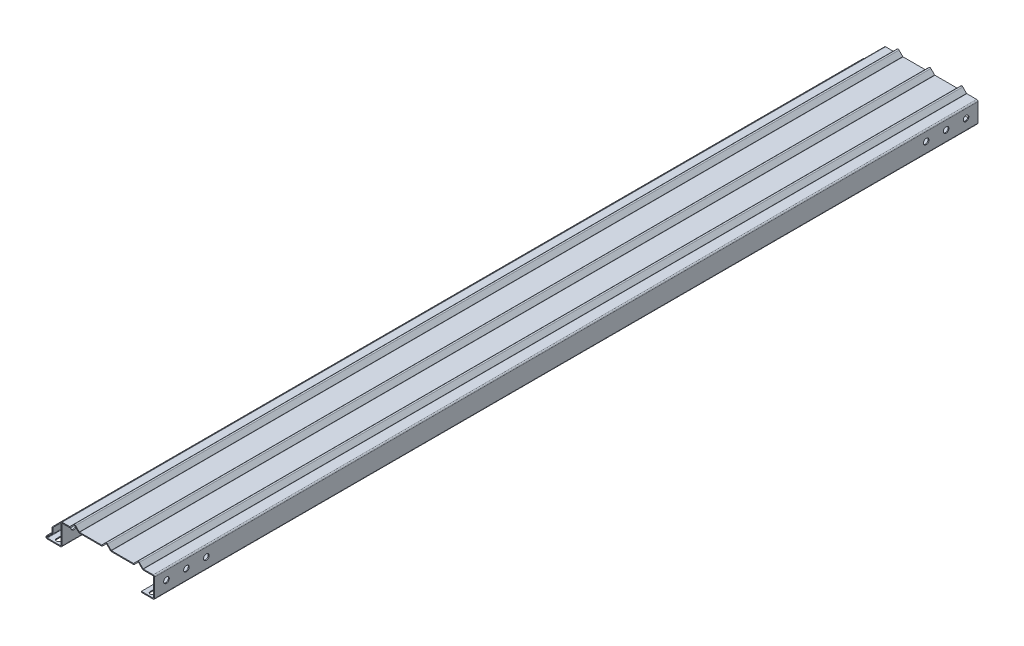
from build123d import *

# Parameters (mm, degrees)
SM_BASE_FLANGE_1_DEPTH = 2066
CUT_EXTRUDE_2_DEPTH    = 2.3
CUT_EXTRUDE_3_REACH    = 2082.367
CUT_EXTRUDE_4_REACH    = 2086.839
SKETCH_8_R             = 7
SKETCH_9_W             = 15
SKETCH_9_H             = 12
CUT_EXTRUDE_5_DEPTH    = 10


# Sheet-metal steps are written as plain solids
with BuildPart() as part:
    # Sketch 1 → 基体-法兰1 (new body)
    with BuildSketch(Plane.XY):
        with BuildLine():
            Line((-35, 15), (-35, 1))
            ThreePointArc((-35, 1), (-34.707106781, 0.292893219), (-34, 0))
            Line((-34, 0), (-1, 0))
            ThreePointArc((-1, 0), (-0.292893219, 0.292893219), (0, 1))
            Line((0, 1), (0, 49.7))
            ThreePointArc((0, 49.7), (0.966547622, 52.033452378), (3.3, 53))
            Line((3.3, 53), (22.085786438, 53))
            ThreePointArc((22.085786438, 53), (22.46846987, 53.076120467), (22.792893219, 53.292893219))
            Line((22.792893219, 53.292893219), (32.166547622, 62.666547622))
            ThreePointArc((32.166547622, 62.666547622), (34.5, 63.633095244), (36.833452378, 62.666547622))
            Line((36.833452378, 62.666547622), (46.207106781, 53.292893219))
            ThreePointArc((46.207106781, 53.292893219), (46.53153013, 53.076120467), (46.914213562, 53))
            Line((46.914213562, 53), (102.085786438, 53))
            ThreePointArc((102.085786438, 53), (102.46846987, 53.076120467), (102.792893219, 53.292893219))
            Line((102.792893219, 53.292893219), (112.166547622, 62.666547622))
            ThreePointArc((112.166547622, 62.666547622), (114.5, 63.633095244), (116.833452378, 62.666547622))
            Line((116.833452378, 62.666547622), (126.207106781, 53.292893219))
            ThreePointArc((126.207106781, 53.292893219), (126.53153013, 53.076120467), (126.914213562, 53))
            Line((126.914213562, 53), (182.085786438, 53))
            ThreePointArc((182.085786438, 53), (182.46846987, 53.076120467), (182.792893219, 53.292893219))
            Line((182.792893219, 53.292893219), (192.166547622, 62.666547622))
            ThreePointArc((192.166547622, 62.666547622), (194.5, 63.633095244), (196.833452378, 62.666547622))
            Line((196.833452378, 62.666547622), (206.207106781, 53.292893219))
            ThreePointArc((206.207106781, 53.292893219), (206.53153013, 53.076120467), (206.914213562, 53))
            Line((206.914213562, 53), (231.7, 53))
            ThreePointArc((231.7, 53), (234.033452378, 52.033452378), (235, 49.7))
            Line((235, 49.7), (235, 3.3))
            ThreePointArc((235, 3.3), (234.033452378, 0.966547622), (231.7, 0))
            Line((231.7, 0), (202, 0))
            Line((202, 0), (202, 2.3))
            Line((202, 2.3), (231.7, 2.3))
            ThreePointArc((231.7, 2.3), (232.407106781, 2.592893219), (232.7, 3.3))
            Line((232.7, 3.3), (232.7, 49.7))
            ThreePointArc((232.7, 49.7), (232.407106781, 50.407106781), (231.7, 50.7))
            Line((231.7, 50.7), (206.914213562, 50.7))
            ThreePointArc((206.914213562, 50.7), (205.651358236, 50.951197543), (204.580761184, 51.666547622))
            Line((204.580761184, 51.666547622), (195.207106781, 61.040202025))
            ThreePointArc((195.207106781, 61.040202025), (194.5, 61.333095244), (193.792893219, 61.040202025))
            Line((193.792893219, 61.040202025), (184.419238816, 51.666547622))
            ThreePointArc((184.419238816, 51.666547622), (183.348641764, 50.951197543), (182.085786438, 50.7))
            Line((182.085786438, 50.7), (126.914213562, 50.7))
            ThreePointArc((126.914213562, 50.7), (125.651358236, 50.951197543), (124.580761184, 51.666547622))
            Line((124.580761184, 51.666547622), (115.207106781, 61.040202025))
            ThreePointArc((115.207106781, 61.040202025), (114.5, 61.333095244), (113.792893219, 61.040202025))
            Line((113.792893219, 61.040202025), (104.419238816, 51.666547622))
            ThreePointArc((104.419238816, 51.666547622), (103.348641764, 50.951197543), (102.085786438, 50.7))
            Line((102.085786438, 50.7), (46.914213562, 50.7))
            ThreePointArc((46.914213562, 50.7), (45.651358236, 50.951197543), (44.580761184, 51.666547622))
            Line((44.580761184, 51.666547622), (35.207106781, 61.040202025))
            ThreePointArc((35.207106781, 61.040202025), (34.5, 61.333095244), (33.792893219, 61.040202025))
            Line((33.792893219, 61.040202025), (24.419238816, 51.666547622))
            ThreePointArc((24.419238816, 51.666547622), (23.348641764, 50.951197543), (22.085786438, 50.7))
            Line((22.085786438, 50.7), (3.3, 50.7))
            ThreePointArc((3.3, 50.7), (2.592893219, 50.407106781), (2.3, 49.7))
            Line((2.3, 49.7), (2.3, 1))
            ThreePointArc((2.3, 1), (1.333452378, -1.333452378), (-1, -2.3))
            Line((-1, -2.3), (-34, -2.3))
            ThreePointArc((-34, -2.3), (-36.333452378, -1.333452378), (-37.3, 1))
            Line((-37.3, 1), (-37.3, 15))
            Line((-37.3, 15), (-35, 15))
        make_face()
    extrude(amount=SM_BASE_FLANGE_1_DEPTH)

    # 草图6 → 切除-拉伸2 (cut)
    with BuildSketch(Plane.XZ):
        with BuildLine():
            Line((213.5, 2055.5), (213.5, 2045.5))
            ThreePointArc((213.5, 2045.5), (219, 2040), (224.5, 2045.5))
            Line((224.5, 2045.5), (224.5, 2055.5))
            ThreePointArc((224.5, 2055.5), (219, 2061), (213.5, 2055.5))
        make_face()
    cut_extrude_2 = extrude(amount=-CUT_EXTRUDE_2_DEPTH, mode=Mode.SUBTRACT)

    # 草图7 → 切除-拉伸3 (cut, up to next)
    with BuildSketch(Plane.XZ.offset(2.3), mode=Mode.PRIVATE) as cut_extrude_3_sk1:
        with BuildLine():
            Line((-10.5, 2045.5), (-10.5, 2055.5))
            ThreePointArc((-10.5, 2055.5), (-16, 2061), (-21.5, 2055.5))
            Line((-21.5, 2055.5), (-21.5, 2045.5))
            ThreePointArc((-21.5, 2045.5), (-16, 2040), (-10.5, 2045.5))
        make_face()
    cut_extrude_3_tool1 = extrude(cut_extrude_3_sk1.sketch, amount=-CUT_EXTRUDE_3_REACH, mode=Mode.PRIVATE) & part.part
    cut_extrude_3 = cut_extrude_3_tool1.solids().sort_by_distance((-16, -2.3, 2050.5))[0]
    add(cut_extrude_3, mode=Mode.SUBTRACT)

    # 镜向1: 切除-拉伸2, 切除-拉伸3 across plane
    add(cut_extrude_2.mirror(Plane.XY.offset(1033)), mode=Mode.SUBTRACT)
    add(cut_extrude_3.mirror(Plane.XY.offset(1033)), mode=Mode.SUBTRACT)

    # 切除-拉伸4: up to this face of the body (flat: up to its plane)
    cut_extrude_4_end = Plane(part.part.faces().sort_by_distance((0, 25.35, 1033))[0])
    # 草图8 → 切除-拉伸4 (cut, up to the picked face)
    with BuildSketch(Plane(origin=(235, 0, 0), x_dir=(0, 0, -1), z_dir=(1, 0, 0)), mode=Mode.PRIVATE) as cut_extrude_4_sk1:
        with Locations((-2036, 28)):
            Circle(SKETCH_8_R)
    cut_extrude_4_tool1 = split(extrude(cut_extrude_4_sk1.sketch, amount=-CUT_EXTRUDE_4_REACH, mode=Mode.PRIVATE), bisect_by=cut_extrude_4_end, keep=Keep.BOTH, mode=Mode.PRIVATE)
    # 草图8 → 切除-拉伸4 (cut, up to the picked face)
    with BuildSketch(Plane(origin=(235, 0, 0), x_dir=(0, 0, -1), z_dir=(1, 0, 0)), mode=Mode.PRIVATE) as cut_extrude_4_sk2:
        with Locations((-1986, 28)):
            Circle(SKETCH_8_R)
    cut_extrude_4_tool2 = split(extrude(cut_extrude_4_sk2.sketch, amount=-CUT_EXTRUDE_4_REACH, mode=Mode.PRIVATE), bisect_by=cut_extrude_4_end, keep=Keep.BOTH, mode=Mode.PRIVATE)
    # 草图8 → 切除-拉伸4 (cut, up to the picked face)
    with BuildSketch(Plane(origin=(235, 0, 0), x_dir=(0, 0, -1), z_dir=(1, 0, 0)), mode=Mode.PRIVATE) as cut_extrude_4_sk3:
        with Locations((-1936, 28)):
            Circle(SKETCH_8_R)
    cut_extrude_4_tool3 = split(extrude(cut_extrude_4_sk3.sketch, amount=-CUT_EXTRUDE_4_REACH, mode=Mode.PRIVATE), bisect_by=cut_extrude_4_end, keep=Keep.BOTH, mode=Mode.PRIVATE)
    cut_extrude_4_1 = cut_extrude_4_tool1.solids().sort_by(Axis((235, 28, 2036), (-1, 0, 0)))[0]
    add(cut_extrude_4_1, mode=Mode.SUBTRACT)
    cut_extrude_4_2 = cut_extrude_4_tool2.solids().sort_by(Axis((235, 28, 1986), (-1, 0, 0)))[0]
    add(cut_extrude_4_2, mode=Mode.SUBTRACT)
    cut_extrude_4_3 = cut_extrude_4_tool3.solids().sort_by(Axis((235, 28, 1936), (-1, 0, 0)))[0]
    add(cut_extrude_4_3, mode=Mode.SUBTRACT)
    cut_extrude_4 = cut_extrude_4_1 + cut_extrude_4_2 + cut_extrude_4_3  # 切除-拉伸4 as one shape, for the pattern or mirror that repeats it

    # 镜向2: 切除-拉伸4 across plane
    add(cut_extrude_4.mirror(Plane.XY.offset(1033)), mode=Mode.SUBTRACT)

    # 草图9 → 切除-拉伸5 (cut)
    with BuildSketch(Plane.ZY.offset(37.3)):
        with Locations((7.5, 9)):
            Rectangle(SKETCH_9_W, SKETCH_9_H)
        with Locations((2058.5, 9)):
            Rectangle(SKETCH_9_W, SKETCH_9_H)
    extrude(amount=-CUT_EXTRUDE_5_DEPTH, mode=Mode.SUBTRACT)


solid = part.part
